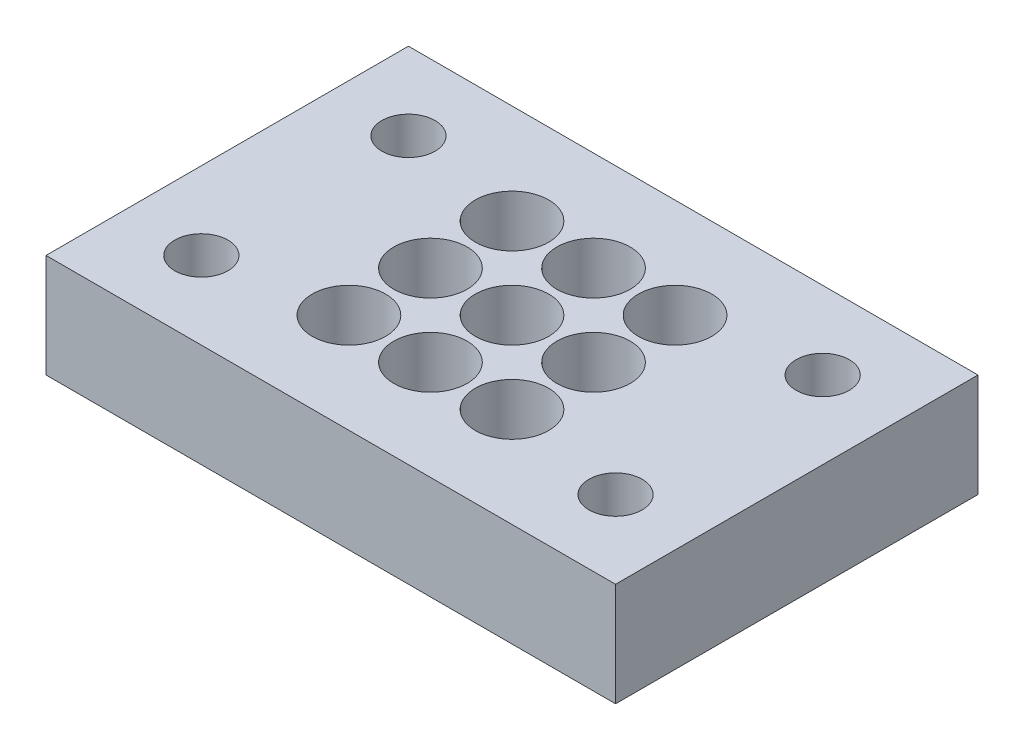
from build123d import *

# Parameters (mm, degrees)
SKETCH1_W           = 69.85
SKETCH1_H           = 44.45
SKETCH1_R           = 3.2639
SKETCH1_R_2         = 4.5
BOSS_EXTRUDE1_DEPTH = 12.7


with BuildPart() as part:
    # Sketch1 → Boss-Extrude1 (new body)
    with BuildSketch(Plane(origin=(0, 0, 0), x_dir=(1, 0, 0), z_dir=(0, 1, 0))):
        with Locations((34.925, 22.225)):
            Rectangle(SKETCH1_W, SKETCH1_H)
        with Locations((9.525, 9.525)):
            Circle(SKETCH1_R, mode=Mode.SUBTRACT)
        with Locations((24.925, 12.225)):
            Circle(SKETCH1_R_2, mode=Mode.SUBTRACT)
        with Locations((24.925, 22.225)):
            Circle(SKETCH1_R_2, mode=Mode.SUBTRACT)
        with Locations((60.325, 9.525)):
            Circle(SKETCH1_R, mode=Mode.SUBTRACT)
        with Locations((34.925, 12.225)):
            Circle(SKETCH1_R_2, mode=Mode.SUBTRACT)
        with Locations((44.925, 12.225)):
            Circle(SKETCH1_R_2, mode=Mode.SUBTRACT)
        with Locations((24.925, 32.225)):
            Circle(SKETCH1_R_2, mode=Mode.SUBTRACT)
        with Locations((34.925, 32.225)):
            Circle(SKETCH1_R_2, mode=Mode.SUBTRACT)
        with Locations((9.525, 34.925)):
            Circle(SKETCH1_R, mode=Mode.SUBTRACT)
        with Locations((34.925, 22.225)):
            Circle(SKETCH1_R_2, mode=Mode.SUBTRACT)
        with Locations((44.925, 22.225)):
            Circle(SKETCH1_R_2, mode=Mode.SUBTRACT)
        with Locations((44.925, 32.225)):
            Circle(SKETCH1_R_2, mode=Mode.SUBTRACT)
        with Locations((60.325, 34.925)):
            Circle(SKETCH1_R, mode=Mode.SUBTRACT)
    extrude(amount=BOSS_EXTRUDE1_DEPTH)


solid = part.part
